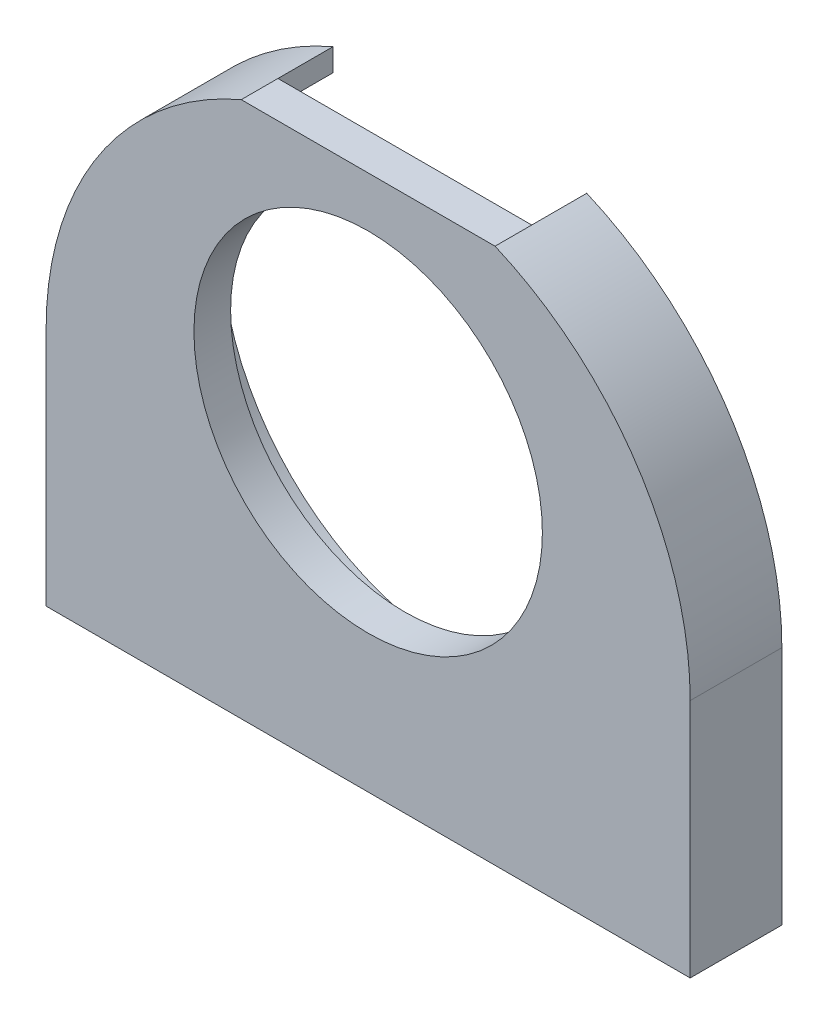
from build123d import *

# Parameters (mm, degrees)
BOSS_EXTRUDE1_DEPTH = 1.5
BOSS_EXTRUDE2_DEPTH = 1
SKETCH4_R           = 4.75
CUT_EXTRUDE1_DEPTH  = 23.898325822


with BuildPart() as part:
    # Sketch1 → Boss-Extrude1 (new body)
    with BuildSketch(Plane.XY):
        with BuildLine():
            Line((5.32, 14.002581212), (5.32, 14.619498126))
            ThreePointArc((5.32, 14.619498126), (1.449679407, 11.382680416), (0, 6.55))
            Line((0, 6.55), (0, 0))
            Line((0, 0), (17.56, 0))
            Line((17.56, 0), (17.56, 6.55))
            ThreePointArc((17.56, 6.55), (16.110320593, 11.382680416), (12.24, 14.619498126))
            Line((12.24, 14.619498126), (12.24, 14.002581212))
            ThreePointArc((12.24, 14.002581212), (8.78, 2), (5.32, 14.002581212))
        make_face()
    extrude(amount=BOSS_EXTRUDE1_DEPTH)

    # Sketch3 → Boss-Extrude2 (add)
    with BuildSketch(Plane.XY.offset(1.5)):
        with BuildLine():
            ThreePointArc((17.56, 6.55), (16.110320593, 11.382680416), (12.24, 14.619498126))
            Line((12.24, 14.619498126), (5.32, 14.619498126))
            ThreePointArc((5.32, 14.619498126), (1.449679407, 11.382680416), (0, 6.55))
            Line((0, 6.55), (0, 0))
            Line((0, 0), (17.56, 0))
            Line((17.56, 0), (17.56, 6.55))
        make_face()
    extrude(amount=BOSS_EXTRUDE2_DEPTH)

    # Sketch4 → Cut-Extrude1 (cut, through all)
    with BuildSketch(Plane(origin=(0, 0, 1.5), x_dir=(-1, 0, 0), z_dir=(0, 0, -1))):
        with Locations((-8.78, 8.5)):
            Circle(SKETCH4_R)
    extrude(amount=-CUT_EXTRUDE1_DEPTH, mode=Mode.SUBTRACT)


solid = part.part
